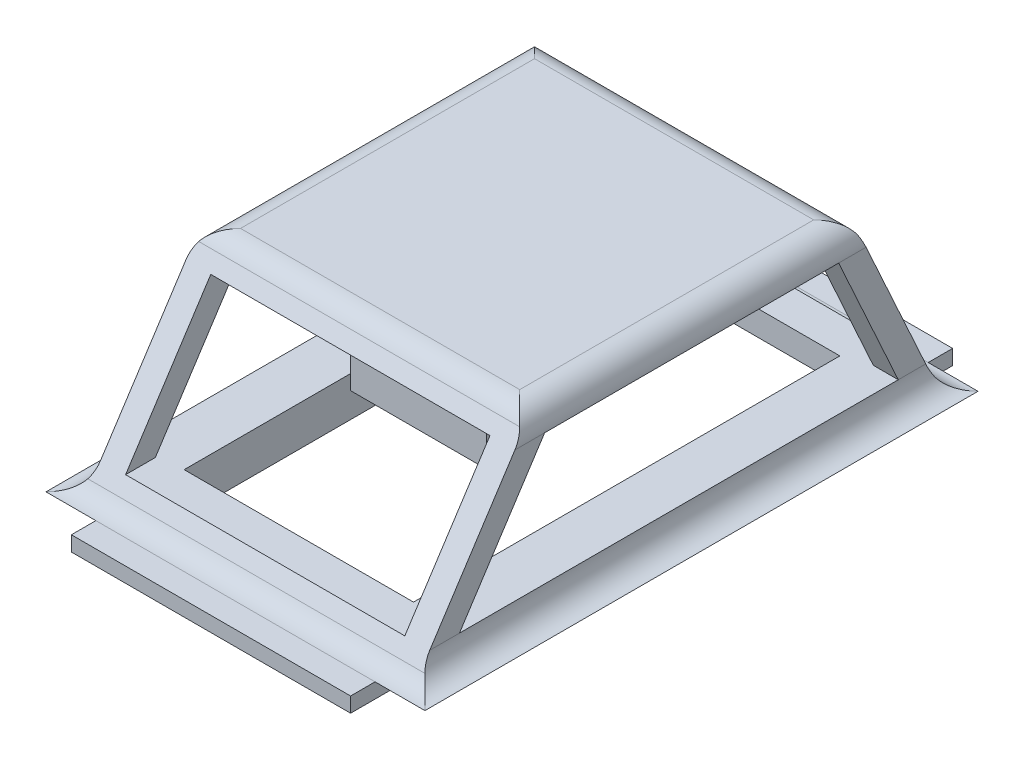
from build123d import *

# Parameters (mm, degrees)
SKETCH1_W           = 200
SKETCH1_H           = 150
BOSS_EXTRUDE1_DEPTH = 280
SKETCH2_W           = 44
SKETCH2_H           = 60
SKETCH2_W_2         = 34
SKETCH2_H_2         = 72.5
CUT_EXTRUDE1_DEPTH  = 280
CUT_EXTRUDE5_DEPTH  = 200
CUT_EXTRUDE8_DEPTH  = 44
CUT_EXTRUDE9_DEPTH  = 44
SKETCH6_W           = 112
SKETCH6_H           = 52.5
CUT_EXTRUDE7_DEPTH  = 280
FILLET1_START       = -100
FILLET1_DEPTH       = 200
FILLET1_START_2     = -76
FILLET1_2_DEPTH     = 10
FILLET1_START_3     = 66
FILLET1_3_DEPTH     = 10
FILLET1_START_4     = -66
FILLET1_4_DEPTH     = 132
FILLET1_START_5     = -281
FILLET1_5_DEPTH     = 282
SKETCH8_W           = 211.062900289
SKETCH8_H           = 77.5
CUT_EXTRUDE10_DEPTH = 280
SKETCH10_W          = 112
SKETCH10_H          = 9.821718876
SKETCH10_H_2        = 221.856562249
SKETCH10_H_3        = 9.821718875
BOSS_EXTRUDE2_DEPTH = 6
SKETCH10_4_W        = 92
SKETCH10_4_H        = 171.032653569
CUT_EXTRUDE11_DEPTH = 10
BOSS_EXTRUDE3_START = -110
SKETCH11_W          = 54.725299756
SKETCH11_H          = 39.681004686
SKETCH11_R          = 1.1
BOSS_EXTRUDE3_DEPTH = 4
FILLET2_R           = 3


with BuildPart() as part:
    # Sketch1 → Boss-Extrude1 (new body)
    with BuildSketch(Plane.XY):
        Rectangle(SKETCH1_W, SKETCH1_H)
    extrude(amount=-BOSS_EXTRUDE1_DEPTH)

    # Sketch2 → Cut-Extrude1 (cut)
    with BuildSketch(Plane.XY):
        with Locations((78, -45)):
            Rectangle(SKETCH2_W, SKETCH2_H)
        with Locations((-78, -45)):
            Rectangle(SKETCH2_W, SKETCH2_H)
        with Locations((83, 38.75)):
            Rectangle(SKETCH2_W_2, SKETCH2_H_2)
        with Locations((-83, 38.75)):
            Rectangle(SKETCH2_W_2, SKETCH2_H_2)
    extrude(amount=-CUT_EXTRUDE1_DEPTH, mode=Mode.SUBTRACT)

    # Sketch3 → Cut-Extrude5 (cut)
    with BuildSketch(Plane.ZY.offset(100)):
        Polygon((-280, 2.5), (-274.399041425, 2.5), (-252, 2.5), (-218.971094498, 75), (-280, 75), align=None)
        Polygon((-236.455453487, 12.5), (-168.766953205, 12.5), (-60.438488841, 12.5), (-94.602997447, 65), (-144.84946991, 65), (-212.537970192, 65), align=None)
        Polygon((-89.179559504, 75), (-42, 2.5), (-5.600958575, 2.5), (0, 2.5), (0, 75), align=None)
    extrude(amount=-CUT_EXTRUDE5_DEPTH, mode=Mode.SUBTRACT)

    # Sketch5 → Cut-Extrude8 (cut)
    with BuildSketch(Plane.ZY.offset(100)):
        Polygon((-264.773291637, -7.125749789), (-270.374250211, -15), (-140, -15), (-140, -7.125749789), align=None)
        Polygon((-15.226708363, -7.125749789), (-140, -7.125749789), (-140, -15), (-9.625749789, -15), align=None)
    extrude(amount=-CUT_EXTRUDE8_DEPTH, mode=Mode.SUBTRACT)

    # Sketch7 → Cut-Extrude9 (cut)
    with BuildSketch(Plane(origin=(100, 0, 0), x_dir=(0, 0, -1), z_dir=(1, 0, 0))):
        Polygon((9.625749789, -15), (15.226708363, -7.125749789), (264.773291637, -7.125749789), (270.374250211, -15), align=None)
    extrude(amount=-CUT_EXTRUDE9_DEPTH, mode=Mode.SUBTRACT)

    # Sketch6 → Cut-Extrude7 (cut)
    with BuildSketch(Plane.XY):
        with Locations((0, 38.75)):
            Rectangle(SKETCH6_W, SKETCH6_H)
    extrude(amount=-CUT_EXTRUDE7_DEPTH, mode=Mode.SUBTRACT)

    # Fillet1: read off the stored shape, not the designer's step
    # Fillet1 outline → Fillet1 (cut)
    with BuildSketch(Plane.YZ.offset(FILLET1_START)):
        with BuildLine():
            Line((-75, 0), (-75, -10))
            ThreePointArc((-75, -10), (-72.071067812, -2.928932188), (-65, 0))
            Line((-65, 0), (-75, 0))
        make_face()
        with BuildLine():
            ThreePointArc((-65, -280), (-72.071067812, -277.071067812), (-75, -270))
            Line((-75, -270), (-75, -280))
            Line((-75, -280), (-65, -280))
        make_face()
        with BuildLine():
            Line((2.5, 0), (-7.5, 0))
            ThreePointArc((-7.5, 0), (-0.428932188, -2.928932188), (2.5, -10))
            Line((2.5, -10), (2.5, 0))
        make_face()
        with BuildLine():
            ThreePointArc((2.5, -270), (-0.428932188, -277.071067812), (-7.5, -280))
            Line((-7.5, -280), (2.5, -280))
            Line((2.5, -280), (2.5, -270))
        make_face()
        with BuildLine():
            Line((75, -89.179559504), (70.454316835, -86.221444616))
            ThreePointArc((70.454316835, -86.221444616), (73.790425711, -89.835564613), (75, -94.602997447))
            Line((75, -94.602997447), (75, -89.179559504))
        make_face()
        with BuildLine():
            ThreePointArc((75, -212.537970192), (73.410042611, -217.948255145), (69.145763344, -221.638115591))
            Line((69.145763344, -221.638115591), (75, -218.971094498))
            Line((75, -218.971094498), (75, -212.537970192))
        make_face()
    extrude(amount=FILLET1_DEPTH, mode=Mode.SUBTRACT)

    # Fillet1 2 outline → Fillet1 2 (add)
    with BuildSketch(Plane.YZ.offset(FILLET1_START_2)):
        with BuildLine():
            ThreePointArc((7.045683165, -44.958114888), (3.709574289, -41.343994891), (2.5, -36.576562057))
            Line((2.5, -36.576562057), (2.5, -258.433124306))
            ThreePointArc((2.5, -258.433124306), (4.089957389, -253.022839352), (8.354236656, -249.332978906))
            Line((8.354236656, -249.332978906), (69.145763344, -221.638115591))
            ThreePointArc((69.145763344, -221.638115591), (73.410042611, -217.948255145), (75, -212.537970192))
            Line((75, -212.537970192), (75, -94.602997447))
            ThreePointArc((75, -94.602997447), (73.790425711, -89.835564613), (70.454316835, -86.221444616))
            Line((70.454316835, -86.221444616), (7.045683165, -44.958114888))
        make_face()
    extrude(amount=FILLET1_2_DEPTH)

    # Fillet1 3 outline → Fillet1 3 (add)
    with BuildSketch(Plane.YZ.offset(FILLET1_START_3)):
        with BuildLine():
            ThreePointArc((7.045683165, -44.958114888), (3.709574289, -41.343994891), (2.5, -36.576562057))
            Line((2.5, -36.576562057), (2.5, -258.433124306))
            ThreePointArc((2.5, -258.433124306), (4.089957389, -253.022839352), (8.354236656, -249.332978906))
            Line((8.354236656, -249.332978906), (69.145763344, -221.638115591))
            ThreePointArc((69.145763344, -221.638115591), (73.410042611, -217.948255145), (75, -212.537970192))
            Line((75, -212.537970192), (75, -94.602997447))
            ThreePointArc((75, -94.602997447), (73.790425711, -89.835564613), (70.454316835, -86.221444616))
            Line((70.454316835, -86.221444616), (7.045683165, -44.958114888))
        make_face()
    extrude(amount=FILLET1_3_DEPTH)

    # Fillet1 4 outline → Fillet1 4 (add)
    with BuildSketch(Plane.YZ.offset(FILLET1_START_4)):
        with BuildLine():
            ThreePointArc((7.045683165, -44.958114888), (3.709574289, -41.343994891), (2.5, -36.576562057))
            Line((2.5, -36.576562057), (2.5, -42))
            Line((2.5, -42), (7.045683165, -44.958114888))
        make_face()
        with BuildLine():
            Line((2.5, -252), (2.5, -258.433124306))
            ThreePointArc((2.5, -258.433124306), (4.089957389, -253.022839352), (8.354236656, -249.332978906))
            Line((8.354236656, -249.332978906), (2.5, -252))
        make_face()
    extrude(amount=FILLET1_4_DEPTH)

    # Fillet1 5 outline → Fillet1 5 (cut)
    with BuildSketch(Plane.XY.offset(FILLET1_START_5)):
        with BuildLine():
            ThreePointArc((56, 75), (63.071067812, 72.071067812), (66, 65))
            Line((66, 65), (66, 12.5))
            ThreePointArc((66, 12.5), (68.928932188, 5.428932188), (76, 2.5))
            Line((76, 2.5), (76, 75))
            Line((76, 75), (56, 75))
        make_face()
        with BuildLine():
            ThreePointArc((-66, 65), (-63.071067812, 72.071067812), (-56, 75))
            Line((-56, 75), (-76, 75))
            Line((-76, 75), (-76, 2.5))
            ThreePointArc((-76, 2.5), (-68.928932188, 5.428932188), (-66, 12.5))
            Line((-66, 12.5), (-66, 65))
        make_face()
        with BuildLine():
            Line((100, 2.5), (90, 2.5))
            ThreePointArc((90, 2.5), (97.071067812, -0.428932188), (100, -7.5))
            Line((100, -7.5), (100, 2.5))
        make_face()
        with BuildLine():
            Line((-90, 2.5), (-100, 2.5))
            Line((-100, 2.5), (-100, -7.5))
            ThreePointArc((-100, -7.5), (-97.071067812, -0.428932188), (-90, 2.5))
        make_face()
        with BuildLine():
            Line((56, -75), (56, -65))
            ThreePointArc((56, -65), (53.071067812, -72.071067812), (46, -75))
            Line((46, -75), (56, -75))
        make_face()
        with BuildLine():
            ThreePointArc((-46, -75), (-53.071067812, -72.071067812), (-56, -65))
            Line((-56, -65), (-56, -75))
            Line((-56, -75), (-46, -75))
        make_face()
    extrude(amount=FILLET1_5_DEPTH, mode=Mode.SUBTRACT)

    # Sketch8 → Cut-Extrude10 (cut)
    with BuildSketch(Plane.XY):
        with Locations((0.683956476, -36.25)):
            Rectangle(SKETCH8_W, SKETCH8_H)
    extrude(amount=-CUT_EXTRUDE10_DEPTH, mode=Mode.SUBTRACT)

    # Sketch10 → Boss-Extrude2 (add)
    # profile 1 of 3: a face of its own
    with BuildSketch(Plane.XZ.offset(-2.5)):
        with Locations((0, -31.665702619)):
            Rectangle(SKETCH10_W, SKETCH10_H)
    # profile 2 of 3: a face of its own
    with BuildSketch(Plane.XZ.offset(-2.5)):
        with Locations((0, -147.504843182)):
            Rectangle(SKETCH10_W, SKETCH10_H_2)
        Polygon((-46, -61.988516397), (-46, -36.754843181), (46, -36.754843181), (46, -61.988516397), (46, -233.021169966), (46, -258.254843181), (-46, -258.254843181), (-46, -233.021169966), align=None, mode=Mode.SUBTRACT)
    # profile 3 of 3: a face of its own
    with BuildSketch(Plane.XZ.offset(-2.5)):
        with Locations((0, -263.343983744)):
            Rectangle(SKETCH10_W, SKETCH10_H_3)
    extrude(amount=BOSS_EXTRUDE2_DEPTH)

    # Sketch10<4> → Cut-Extrude11 (cut)
    with BuildSketch(Plane.XZ.offset(-2.5)):
        with Locations((0, -147.504843182)):
            Rectangle(SKETCH10_4_W, SKETCH10_4_H)
    extrude(amount=-CUT_EXTRUDE11_DEPTH, mode=Mode.SUBTRACT)

    # Sketch11 → Boss-Extrude3 (add)
    with BuildSketch(Plane.XY.offset(BOSS_EXTRUDE3_START)):
        with Locations((0, 45.159497657)):
            Rectangle(SKETCH11_W, SKETCH11_H)
        with Locations((-10.5, 51.409497657)):
            Circle(SKETCH11_R, mode=Mode.SUBTRACT)
        with Locations(Location((10.5, 51.409497657, 0), (0, 0, 180))):
            Circle(SKETCH11_R, mode=Mode.SUBTRACT)
        with Locations((10.5, 38.909497657)):
            Circle(SKETCH11_R, mode=Mode.SUBTRACT)
        with Locations(Location((-10.5, 38.909497657, 0), (0, 0, 180))):
            Circle(SKETCH11_R, mode=Mode.SUBTRACT)
    extrude(amount=-BOSS_EXTRUDE3_DEPTH)

    # Fillet2
    fillet2_edges = [part.edges().sort_by_distance(p)[0] for p in [
        (0, 65, -114),
        (-27.362649878, 65, -112),
        (27.362649878, 65, -112),
        (0, 65, -110),
    ]]
    fillet(fillet2_edges, radius=FILLET2_R)


solid = part.part
